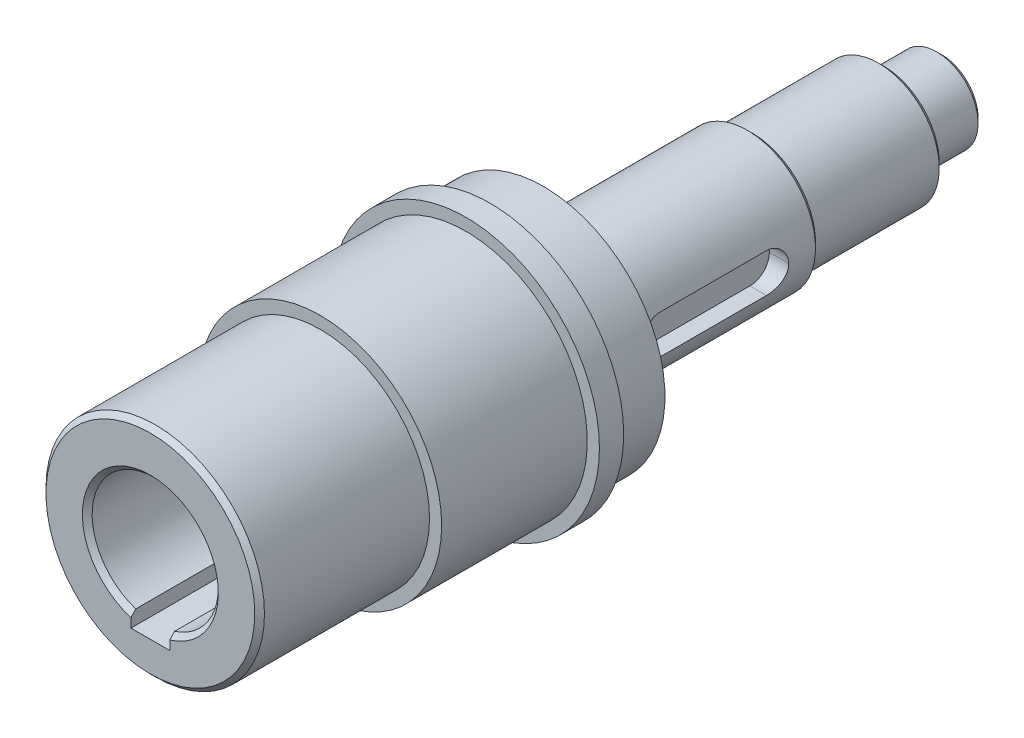
from build123d import *

# Parameters (mm, degrees)
SKETCH_1_R               = 25
EXTRUDE_1_DEPTH          = 30
SKETCH_2_R               = 27.5
EXTRUDE_2_DEPTH          = 5
EXTRUDE_START            = 11
SKETCH_3_R               = 25
EXTRUDE_3_DEPTH          = 11
SKETCH_4_R               = 14
EXTRUDE_4_DEPTH          = 43
SKETCH_5_R               = 12.5
EXTRUDE_5_DEPTH          = 27
SKETCH_6_R               = 8.5
EXTRUDE_6_DEPTH          = 12
CUT_EXTRUDE_1_DEPTH      = 4
CUT_EXTRUDE_1_DEPTH_BACK = 4
SKETCH_7_W               = 4
SKETCH_7_H               = 30
FILLET_1_R               = 4
CHAMFER_1_SIZE           = 1
SKETCH_8_R               = 22.5
EXTRUDE_7_DEPTH          = 35
CHAMFER_2_SIZE           = 1
SKETCH_9_R               = 13
CUT_EXTRUDE_2_DEPTH      = 40
CHAMFER_3_SIZE           = 1
CUT_EXTRUDE_3_DEPTH      = 34


with BuildPart() as part:
    # 草图1 → 凸台-拉伸1 (new body)
    with BuildSketch(Plane.XY):
        Circle(SKETCH_1_R)
    extrude(amount=EXTRUDE_1_DEPTH)

    # 草图2 → 凸台-拉伸2 (add)
    with BuildSketch(Plane(origin=(0, 0, 0), x_dir=(-1, 0, 0), z_dir=(0, 0, -1))):
        Circle(SKETCH_2_R)
    extrude(amount=EXTRUDE_2_DEPTH)

    # 草图3 → 凸台-拉伸3 (add)
    with BuildSketch(Plane(origin=(0, 0, -5), x_dir=(-1, 0, 0), z_dir=(0, 0, -1)).offset(EXTRUDE_START)):
        Circle(SKETCH_3_R)
    extrude(amount=-EXTRUDE_3_DEPTH)

    # 草图4 → 凸台-拉伸4 (add)
    with BuildSketch(Plane(origin=(0, 0, -16), x_dir=(-1, 0, 0), z_dir=(0, 0, -1))):
        Circle(SKETCH_4_R)
    extrude(amount=EXTRUDE_4_DEPTH)

    # 草图5 → 凸台-拉伸5 (add)
    with BuildSketch(Plane(origin=(0, 0, -59), x_dir=(-1, 0, 0), z_dir=(0, 0, -1))):
        Circle(SKETCH_5_R)
    extrude(amount=EXTRUDE_5_DEPTH)

    # 草图6 → 凸台-拉伸6 (add)
    with BuildSketch(Plane(origin=(0, 0, -86), x_dir=(-1, 0, 0), z_dir=(0, 0, -1))):
        Circle(SKETCH_6_R)
    extrude(amount=EXTRUDE_6_DEPTH)

    # 草图7 → 切除-拉伸1 (cut, two sides: drawn at the far end of the back side and taken through both)
    with BuildSketch(Plane(origin=(0, 0, 0), x_dir=(1, 0, 0), z_dir=(0, 1, 0)).offset(-CUT_EXTRUDE_1_DEPTH_BACK)):
        with Locations((12, 37.5)):
            Rectangle(SKETCH_7_W, SKETCH_7_H)
    extrude(amount=CUT_EXTRUDE_1_DEPTH + CUT_EXTRUDE_1_DEPTH_BACK, mode=Mode.SUBTRACT)

    # 圆角1
    fillet_1_edges = [part.edges().sort_by_distance(p)[0] for p in [
        (11.708203932, 4, -22.5),
        (11.708203932, -4, -22.5),
        (11.708203932, -4, -52.5),
        (11.708203932, 4, -52.5),
    ]]
    fillet(fillet_1_edges, radius=FILLET_1_R - 0.0001)  # a hair under: the kernel refuses the full size

    # 倒角1
    chamfer_1_edges = [part.edges().sort_by_distance(p)[0] for p in [
        (14, 0, -59),
        (12.5, 0, -86),
        (8.5, 0, -98),
    ]]
    chamfer(chamfer_1_edges, length=CHAMFER_1_SIZE)

    # 草图8 → 凸台-拉伸7 (add)
    with BuildSketch(Plane.XY.offset(30)):
        Circle(SKETCH_8_R)
    extrude(amount=EXTRUDE_7_DEPTH)

    # 倒角2
    chamfer_2_edges = [part.edges().sort_by_distance(p)[0] for p in [
        (-22.5, 0, 65),
    ]]
    chamfer(chamfer_2_edges, length=CHAMFER_2_SIZE)

    # 草图9 → 切除-拉伸2 (cut)
    with BuildSketch(Plane.XY.offset(65)):
        Circle(SKETCH_9_R)
    extrude(amount=-CUT_EXTRUDE_2_DEPTH, mode=Mode.SUBTRACT)

    # 倒角3
    chamfer_3_edges = [part.edges().sort_by_distance(p)[0] for p in [
        (-13, 0, 65),
    ]]
    chamfer(chamfer_3_edges, length=CHAMFER_3_SIZE)

    # 草图10 → 切除-拉伸3 (cut)
    with BuildSketch(Plane.XY.offset(65)):
        Polygon((-4, -13), (-4, -8.881570562), (4, -8.881570562), (4, -13), (4, -15.3), (-4, -15.3), align=None)
    extrude(amount=-CUT_EXTRUDE_3_DEPTH, mode=Mode.SUBTRACT)


solid = part.part
